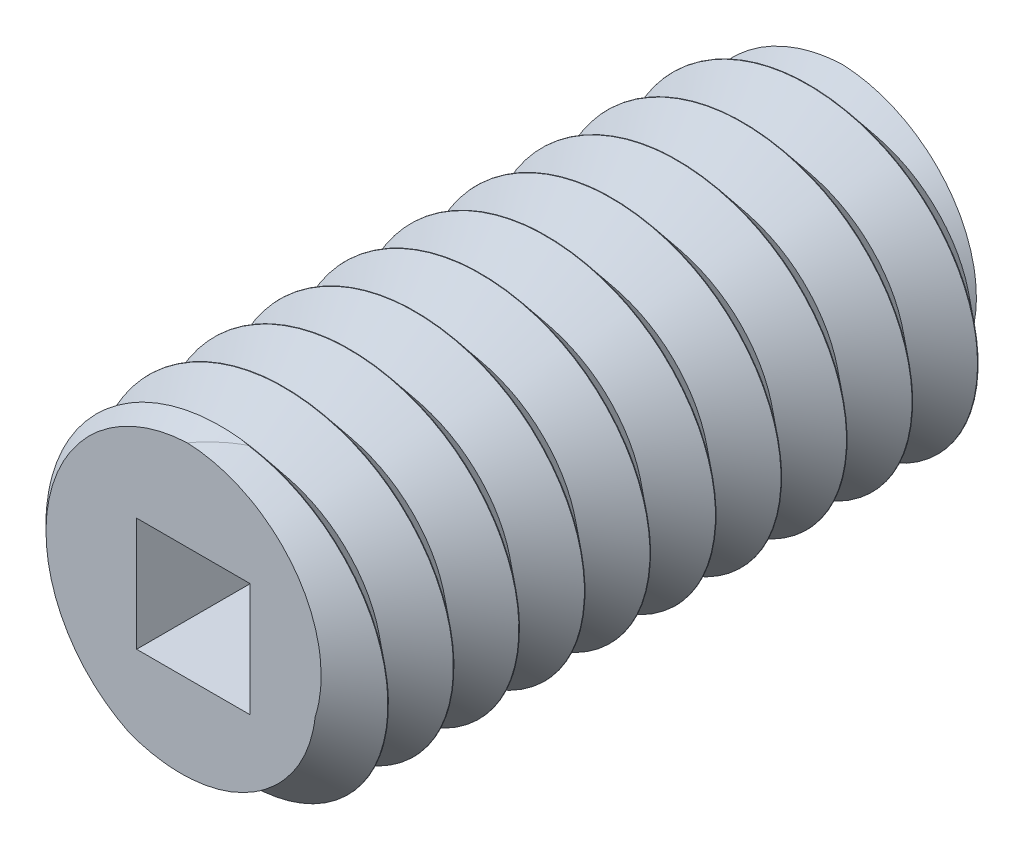
from build123d import *

# Parameters (mm, degrees)
SKETCH1_R               = 3
BOSS_EXTRUDE1_DEPTH     = 12
CHAMFER1_SIZE           = 0.3
CUT_SWEEP3_PITCH        = 1.2
SKETCH4_W               = 2.08
SKETCH4_H               = 2.08
CUT_EXTRUDE1_DEPTH      = 5.5
CUT_EXTRUDE1_DRAFT      = -2
MIRROR1_COPY_1_SKETCH_W = 2.08
MIRROR1_COPY_1_SKETCH_H = 2.08
MIRROR1_COPY_1_DEPTH    = 5.5
MIRROR1_COPY_1_DRAFT    = -2


with BuildPart() as part:
    # Sketch1 → Boss-Extrude1 (new body)
    with BuildSketch(Plane.XY):
        Circle(SKETCH1_R)
    extrude(amount=BOSS_EXTRUDE1_DEPTH)

    # Chamfer1
    chamfer1_edges = [part.edges().sort_by_distance(p)[0] for p in [
        (-3, 0, 0),
        (-3, 0, 12),
    ]]
    chamfer(chamfer1_edges, length=CHAMFER1_SIZE)

    # Cut-Sweep3: the profile of Sketch3 profile screwed along a right-hand helix of 29.166667 turns, 8 arcs to a turn; built about Z, then put on its axis
    cut_sweep3_z = Axis((0, 0, 0), (0, 0, 1))
    cut_sweep3_corners = [(3.0003, 0, 0.334882135), (3.0003, 0, -0.855613698), (2.28, 0, -0.260365781)]
    with BuildLine(mode=Mode.PRIVATE) as cut_sweep3_profile:
        Line(cut_sweep3_corners[0], cut_sweep3_corners[1])
        Line(cut_sweep3_corners[1], cut_sweep3_corners[2])
        Line(cut_sweep3_corners[2], cut_sweep3_corners[0])
    cut_sweep3_cap = Face(cut_sweep3_profile.wire())
    cut_sweep3_turn_angles = [0, 22.5, 45, 67.5, 90, 112.5, 135, 157.5, 180, 202.5, 225, 247.5, 270, 292.5, 315, 337.5, 360]
    cut_sweep3_turn_weights = [1, 0.9238795325112867, 1, 0.9238795325112867, 1, 0.9238795325112867, 1, 0.9238795325112867, 1, 0.9238795325112867, 1, 0.9238795325112867, 1, 0.9238795325112867, 1, 0.9238795325112867, 1]
    cut_sweep3_turn_rails = [Edge.make_bspline([Vector(p[0], p[1], 0).rotate(cut_sweep3_z, cut_sweep3_turn_angles[k]) / cut_sweep3_turn_weights[k] + Vector(0, 0, p[2] + CUT_SWEEP3_PITCH * cut_sweep3_turn_angles[k] / 360) for k in range(17)], [0, 0, 0, 1, 1, 2, 2, 3, 3, 4, 4, 5, 5, 6, 6, 7, 7, 8, 8, 8], 2, cut_sweep3_turn_weights) for p in cut_sweep3_corners]
    cut_sweep3_turn_sides = [Face.make_surface_from_curves(cut_sweep3_turn_rails[p[0]], cut_sweep3_turn_rails[p[1]]) for p in [(0, 1), (1, 2), (2, 0)]]
    cut_sweep3_last_angles = [10440, 10462.5, 10485, 10492.5, 10500]
    cut_sweep3_last_weights = [1, 0.9238795325112867, 1, 0.9914448613738477, 1]
    cut_sweep3_last_rails = [Edge.make_bspline([Vector(p[0], p[1], 0).rotate(cut_sweep3_z, cut_sweep3_last_angles[k]) / cut_sweep3_last_weights[k] + Vector(0, 0, p[2] + CUT_SWEEP3_PITCH * cut_sweep3_last_angles[k] / 360) for k in range(5)], [0, 0, 0, 1, 1, 2, 2, 2], 2, cut_sweep3_last_weights) for p in cut_sweep3_corners]
    cut_sweep3_last_sides = [Face.make_surface_from_curves(cut_sweep3_last_rails[p[0]], cut_sweep3_last_rails[p[1]]) for p in [(0, 1), (1, 2), (2, 0)]]
    cut_sweep3 = Plane(origin=(0, 0, 0), x_dir=(0, -1, 0), z_dir=(0, 0, 1)) * Solid(Shell([*[p.moved(Location((0, 0, CUT_SWEEP3_PITCH * i))) for i in range(29) for p in cut_sweep3_turn_sides], *cut_sweep3_last_sides, cut_sweep3_cap, cut_sweep3_cap.rotate(cut_sweep3_z, 10500).moved(Location((0, 0, CUT_SWEEP3_PITCH * 10500 / 360)))]))
    add(cut_sweep3, mode=Mode.SUBTRACT)


with BuildPart() as cut_extrude1_tool:
    # Sketch4 → Cut-Extrude1 (with draft: the straight prism first)
    with BuildSketch(Plane(origin=(0, 0, 0), x_dir=(-1, 0, 0), z_dir=(0, 0, -1))):
        Rectangle(SKETCH4_W, SKETCH4_H)
    extrude(amount=-CUT_EXTRUDE1_DEPTH)
    # Cut-Extrude1: the draft: its side faces are tilted about the plane it starts from
    cut_extrude1_sides = [cut_extrude1_tool.faces().sort_by_distance(p)[0] for p in [
        (0, -1.04, 2.75),
        (-1.04, 0, 2.75),
        (0, 1.04, 2.75),
        (1.04, 0, 2.75),
    ]]
    draft(cut_extrude1_sides, Plane(origin=(0, 0, 0), x_dir=(-1, 0, 0), z_dir=(0, 0, -1)), CUT_EXTRUDE1_DRAFT)


with BuildPart() as part_1:
    add(part.part)

    # Cut-Extrude1: cut by cut_extrude1_tool
    add(cut_extrude1_tool.part, mode=Mode.SUBTRACT)


with BuildPart() as mirror1_copy_1_tool:
    # Mirror1 copy 1 sketch → Mirror1 copy 1 (with draft: the straight prism first)
    with BuildSketch(Plane(origin=(0, 0, 12), x_dir=(-1, 0, 0), z_dir=(0, 0, 1))):
        Rectangle(MIRROR1_COPY_1_SKETCH_W, MIRROR1_COPY_1_SKETCH_H)
    extrude(amount=-MIRROR1_COPY_1_DEPTH)
    # Mirror1 copy 1: the draft: its side faces are tilted about the plane it starts from
    mirror1_copy_1_sides = [mirror1_copy_1_tool.faces().sort_by_distance(p)[0] for p in [
        (0, -1.04, 9.25),
        (-1.04, 0, 9.25),
        (0, 1.04, 9.25),
        (1.04, 0, 9.25),
    ]]
    draft(mirror1_copy_1_sides, Plane(origin=(0, 0, 12), x_dir=(-1, 0, 0), z_dir=(0, 0, 1)), MIRROR1_COPY_1_DRAFT)


with BuildPart() as part_2:
    add(part_1.part)

    # Mirror1 copy 1: cut by mirror1_copy_1_tool
    add(mirror1_copy_1_tool.part, mode=Mode.SUBTRACT)


solid = part_2.part
